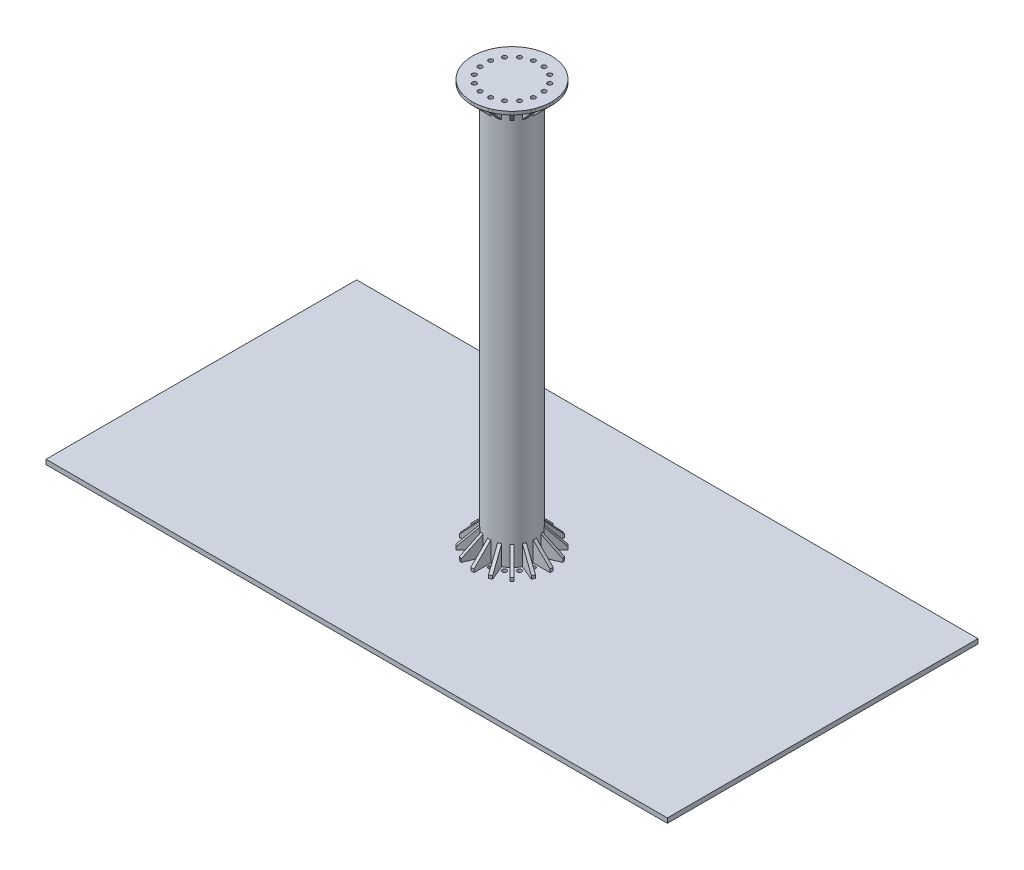
from build123d import *

# Parameters (mm, degrees)
SKETCH1_W                = 2000
SKETCH1_H                = 1000
BOSS_EXTRUDE1_DEPTH      = 15
SKETCH2_R                = 73.5
BOSS_EXTRUDE2_DEPTH      = 1300
SKETCH3_R                = 127.5
BOSS_EXTRUDE3_DEPTH      = 10
RIB1_START               = -5
RIB1_DEPTH               = 10
CIRPATTERN1_COUNT        = 16
MIRROR1_START            = -5
MIRROR1_DEPTH            = 10
MIRROR1_2_DEPTH          = 10
MIRROR1_3_DEPTH          = 10
MIRROR1_4_DEPTH          = 10
MIRROR1_5_DEPTH          = 10
MIRROR1_6_DEPTH          = 10
MIRROR1_7_DEPTH          = 10
MIRROR1_8_DEPTH          = 10
SKETCH6_R                = 7
CUT_EXTRUDE1_DEPTH       = 1727.043162844
CIRPATTERN2_COUNT        = 16
MIRROR2_COPY_1_SKETCH_R  = 7
MIRROR2_COPY_1_DEPTH     = 1727.043162844
MIRROR2_COPY_2_SKETCH_R  = 7
MIRROR2_COPY_2_DEPTH     = 1727.043162844
MIRROR2_COPY_3_SKETCH_R  = 7
MIRROR2_COPY_3_DEPTH     = 1727.043162844
MIRROR2_COPY_4_SKETCH_R  = 7
MIRROR2_COPY_4_DEPTH     = 1727.043162844
MIRROR2_COPY_5_SKETCH_R  = 7
MIRROR2_COPY_5_DEPTH     = 1727.043162844
MIRROR2_COPY_6_SKETCH_R  = 7
MIRROR2_COPY_6_DEPTH     = 1727.043162844
MIRROR2_COPY_7_SKETCH_R  = 7
MIRROR2_COPY_7_DEPTH     = 1727.043162844
MIRROR2_COPY_8_SKETCH_R  = 7
MIRROR2_COPY_8_DEPTH     = 1727.043162844
MIRROR2_COPY_9_SKETCH_R  = 7
MIRROR2_COPY_9_DEPTH     = 1727.043162844
MIRROR2_COPY_10_SKETCH_R = 7
MIRROR2_COPY_10_DEPTH    = 1727.043162844
MIRROR2_COPY_11_SKETCH_R = 7
MIRROR2_COPY_11_DEPTH    = 1727.043162844
MIRROR2_COPY_12_SKETCH_R = 7
MIRROR2_COPY_12_DEPTH    = 1727.043162844
MIRROR2_COPY_13_SKETCH_R = 7
MIRROR2_COPY_13_DEPTH    = 1727.043162844
MIRROR2_COPY_14_SKETCH_R = 7
MIRROR2_COPY_14_DEPTH    = 1727.043162844
MIRROR2_COPY_15_SKETCH_R = 7
MIRROR2_COPY_15_DEPTH    = 1727.043162844


with BuildPart() as part:
    # Sketch1 → Boss-Extrude1 (new body)
    with BuildSketch(Plane(origin=(0, 0, 0), x_dir=(1, 0, 0), z_dir=(0, 1, 0))):
        Rectangle(SKETCH1_W, SKETCH1_H)
    extrude(amount=BOSS_EXTRUDE1_DEPTH)

    # Sketch2 → Boss-Extrude2 (add)
    with BuildSketch(Plane(origin=(0, 15, 0), x_dir=(1, 0, 0), z_dir=(0, 1, 0))):
        with Locations(Location((0, 0, 0), (0, 0, 90))):
            Circle(SKETCH2_R)
    extrude(amount=BOSS_EXTRUDE2_DEPTH)

    # Sketch3 → Boss-Extrude3 (add)
    with BuildSketch(Plane(origin=(0, 1315, 0), x_dir=(1, 0, 0), z_dir=(0, 1, 0))):
        with Locations(Location((0, 0, 0), (0, 0, 270))):
            Circle(SKETCH3_R)
    extrude(amount=BOSS_EXTRUDE3_DEPTH)

    # Rib1: read off the stored shape, not the designer's step
    # Rib1 outline → Rib1 (add)
    with BuildSketch(Plane.XY.offset(RIB1_START)):
        Polygon((127.401923062, 1315), (73.32973476, 1315), (73.32973476, 1260.82973476), (127.5, 1315), (127.5, 1325), (127.401923062, 1325), align=None)
    rib1 = extrude(amount=RIB1_DEPTH)

    # CirPattern1: Rib1 ×16 about axis
    cirpattern1_axis = Axis((0, 0, 0), (0, 1, 0))
    for i in range(1, CIRPATTERN1_COUNT):
        add(rib1.rotate(cirpattern1_axis, i * 360 / CIRPATTERN1_COUNT))

    # Mirror1: read off the stored shape, not the designer's step
    # Mirror1 outline → Mirror1 (add)
    with BuildSketch(Plane.XY.offset(MIRROR1_START)):
        Polygon((127.5, 14), (127.5, 25), (72.5, 80), (-72.5, 80), (-127.5, 25), (-127.5, 14), align=None)
    extrude(amount=MIRROR1_DEPTH)

    # Mirror1 2 outline → Mirror1 2 (add)
    with BuildSketch(Plane(origin=(0, 0, 0), x_dir=(0.9238795325112862, 0, -0.38268343236509117), z_dir=(0.3826834323650911, 0, 0.9238795325112863)).offset(MIRROR1_START)):
        Polygon((127.5, 14), (127.5, 25), (72.5, 80), (-72.5, 80), (-127.5, 25), (-127.5, 14), align=None)
    extrude(amount=MIRROR1_2_DEPTH)

    # Mirror1 3 outline → Mirror1 3 (add)
    with BuildSketch(Plane(origin=(0, 0, 0), x_dir=(0.707106781186546, 0, -0.707106781186549), z_dir=(0.707106781186549, 0, 0.707106781186546)).offset(MIRROR1_START)):
        Polygon((127.5, 14), (127.5, 25), (72.5, 80), (-72.5, 80), (-127.5, 25), (-127.5, 14), align=None)
    extrude(amount=MIRROR1_3_DEPTH)

    # Mirror1 4 outline → Mirror1 4 (add)
    with BuildSketch(Plane(origin=(0, 0, 0), x_dir=(0, 1, 0), z_dir=(0.923879532511288, 0, 0.382683432365087)).offset(MIRROR1_START)):
        Polygon((14, -127.5), (25, -127.5), (80, -72.5), (80, 72.5), (25, 127.5), (14, 127.5), align=None)
    extrude(amount=MIRROR1_4_DEPTH)

    # Mirror1 5 outline → Mirror1 5 (add)
    with BuildSketch(Plane.YZ.offset(MIRROR1_START)):
        Polygon((14, -127.5), (25, -127.5), (80, -72.5), (80, 72.5), (25, 127.5), (14, 127.5), align=None)
    extrude(amount=MIRROR1_5_DEPTH)

    # Mirror1 6 outline → Mirror1 6 (add)
    with BuildSketch(Plane(origin=(0, 0, 0), x_dir=(0, 1, 0), z_dir=(0.9238795325112851, 0, -0.38268343236509406)).offset(MIRROR1_START)):
        Polygon((14, -127.5), (25, -127.5), (80, -72.5), (80, 72.5), (25, 127.5), (14, 127.5), align=None)
    extrude(amount=MIRROR1_6_DEPTH)

    # Mirror1 7 outline → Mirror1 7 (add)
    with BuildSketch(Plane(origin=(0, 0, 0), x_dir=(0.7071067811865509, 0, 0.707106781186544), z_dir=(0.707106781186544, 0, -0.707106781186551)).offset(MIRROR1_START)):
        Polygon((-127.5, -14), (-127.5, -25), (-72.5, -80), (72.5, -80), (127.5, -25), (127.5, -14), align=None)
    extrude(amount=MIRROR1_7_DEPTH)

    # Mirror1 8 outline → Mirror1 8 (add)
    with BuildSketch(Plane(origin=(0, 0, 0), x_dir=(0.9238795325112891, 0, 0.3826834323650842), z_dir=(0.3826834323650841, 0, -0.9238795325112892)).offset(MIRROR1_START)):
        Polygon((-127.5, -14), (-127.5, -25), (-72.5, -80), (72.5, -80), (127.5, -25), (127.5, -14), align=None)
    extrude(amount=MIRROR1_8_DEPTH)

    # Sketch6 → Cut-Extrude1 (cut, through all)
    with BuildSketch(Plane.XZ.offset(-1315)):
        with Locations(Location((17.175298589, -85.797780381, 0), (0, 0, 270))):
            Circle(SKETCH6_R)
    cut_extrude1 = extrude(amount=-CUT_EXTRUDE1_DEPTH, mode=Mode.SUBTRACT)

    # CirPattern2: Cut-Extrude1 ×16 about axis
    cirpattern2_axis = Axis((0, 0, 0), (0, 1, 0))
    for i in range(1, CIRPATTERN2_COUNT):
        add(cut_extrude1.rotate(cirpattern2_axis, i * 360 / CIRPATTERN2_COUNT), mode=Mode.SUBTRACT)

    # Mirror2: Cut-Extrude1 across plane
    add(cut_extrude1.mirror(Plane.ZX.offset(670)), mode=Mode.SUBTRACT)

    # Mirror2 copy 1 sketch → Mirror2 copy 1 (cut, through all)
    with BuildSketch(Plane(origin=(0, 25, 0), x_dir=(0.9238795325112867, 0, -0.3826834323650898), z_dir=(0, 1, 0))):
        with Locations((17.175298589, 85.797780381)):
            Circle(MIRROR2_COPY_1_SKETCH_R)
    extrude(amount=-MIRROR2_COPY_1_DEPTH, mode=Mode.SUBTRACT)

    # Mirror2 copy 2 sketch → Mirror2 copy 2 (cut, through all)
    with BuildSketch(Plane(origin=(0, 25, 0), x_dir=(0.7071067811865476, 0, -0.7071067811865475), z_dir=(0, 1, 0))):
        with Locations((17.175298589, 85.797780381)):
            Circle(MIRROR2_COPY_2_SKETCH_R)
    extrude(amount=-MIRROR2_COPY_2_DEPTH, mode=Mode.SUBTRACT)

    # Mirror2 copy 3 sketch → Mirror2 copy 3 (cut, through all)
    with BuildSketch(Plane(origin=(0, 25, 0), x_dir=(0.38268343236508984, 0, -0.9238795325112867), z_dir=(0, 1, 0))):
        with Locations((17.175298589, 85.797780381)):
            Circle(MIRROR2_COPY_3_SKETCH_R)
    extrude(amount=-MIRROR2_COPY_3_DEPTH, mode=Mode.SUBTRACT)

    # Mirror2 copy 4 sketch → Mirror2 copy 4 (cut, through all)
    with BuildSketch(Plane(origin=(0, 25, 0), x_dir=(0, 0, -1), z_dir=(0, 1, 0))):
        with Locations((17.175298589, 85.797780381)):
            Circle(MIRROR2_COPY_4_SKETCH_R)
    extrude(amount=-MIRROR2_COPY_4_DEPTH, mode=Mode.SUBTRACT)

    # Mirror2 copy 5 sketch → Mirror2 copy 5 (cut, through all)
    with BuildSketch(Plane(origin=(0, 25, 0), x_dir=(-0.3826834323650897, 0, -0.9238795325112867), z_dir=(0, 1, 0))):
        with Locations((17.175298589, 85.797780381)):
            Circle(MIRROR2_COPY_5_SKETCH_R)
    extrude(amount=-MIRROR2_COPY_5_DEPTH, mode=Mode.SUBTRACT)

    # Mirror2 copy 6 sketch → Mirror2 copy 6 (cut, through all)
    with BuildSketch(Plane(origin=(0, 25, 0), x_dir=(-0.7071067811865475, 0, -0.7071067811865476), z_dir=(0, 1, 0))):
        with Locations((17.175298589, 85.797780381)):
            Circle(MIRROR2_COPY_6_SKETCH_R)
    extrude(amount=-MIRROR2_COPY_6_DEPTH, mode=Mode.SUBTRACT)

    # Mirror2 copy 7 sketch → Mirror2 copy 7 (cut, through all)
    with BuildSketch(Plane(origin=(0, 25, 0), x_dir=(-0.9238795325112867, 0, -0.3826834323650899), z_dir=(0, 1, 0))):
        with Locations((17.175298589, 85.797780381)):
            Circle(MIRROR2_COPY_7_SKETCH_R)
    extrude(amount=-MIRROR2_COPY_7_DEPTH, mode=Mode.SUBTRACT)

    # Mirror2 copy 8 sketch → Mirror2 copy 8 (cut, through all)
    with BuildSketch(Plane(origin=(0, 25, 0), x_dir=(-1, 0, 0), z_dir=(0, 1, 0))):
        with Locations((17.175298589, 85.797780381)):
            Circle(MIRROR2_COPY_8_SKETCH_R)
    extrude(amount=-MIRROR2_COPY_8_DEPTH, mode=Mode.SUBTRACT)

    # Mirror2 copy 9 sketch → Mirror2 copy 9 (cut, through all)
    with BuildSketch(Plane(origin=(0, 25, 0), x_dir=(-0.9238795325112868, 0, 0.38268343236508967), z_dir=(0, 1, 0))):
        with Locations((17.175298589, 85.797780381)):
            Circle(MIRROR2_COPY_9_SKETCH_R)
    extrude(amount=-MIRROR2_COPY_9_DEPTH, mode=Mode.SUBTRACT)

    # Mirror2 copy 10 sketch → Mirror2 copy 10 (cut, through all)
    with BuildSketch(Plane(origin=(0, 25, 0), x_dir=(-0.7071067811865477, 0, 0.7071067811865475), z_dir=(0, 1, 0))):
        with Locations((17.175298589, 85.797780381)):
            Circle(MIRROR2_COPY_10_SKETCH_R)
    extrude(amount=-MIRROR2_COPY_10_DEPTH, mode=Mode.SUBTRACT)

    # Mirror2 copy 11 sketch → Mirror2 copy 11 (cut, through all)
    with BuildSketch(Plane(origin=(0, 25, 0), x_dir=(-0.3826834323650895, 0, 0.9238795325112868), z_dir=(0, 1, 0))):
        with Locations((17.175298589, 85.797780381)):
            Circle(MIRROR2_COPY_11_SKETCH_R)
    extrude(amount=-MIRROR2_COPY_11_DEPTH, mode=Mode.SUBTRACT)

    # Mirror2 copy 12 sketch → Mirror2 copy 12 (cut, through all)
    with BuildSketch(Plane.ZX.offset(25)):
        with Locations((17.175298589, 85.797780381)):
            Circle(MIRROR2_COPY_12_SKETCH_R)
    extrude(amount=-MIRROR2_COPY_12_DEPTH, mode=Mode.SUBTRACT)

    # Mirror2 copy 13 sketch → Mirror2 copy 13 (cut, through all)
    with BuildSketch(Plane(origin=(0, 25, 0), x_dir=(0.38268343236509, 0, 0.9238795325112866), z_dir=(0, 1, 0))):
        with Locations((17.175298589, 85.797780381)):
            Circle(MIRROR2_COPY_13_SKETCH_R)
    extrude(amount=-MIRROR2_COPY_13_DEPTH, mode=Mode.SUBTRACT)

    # Mirror2 copy 14 sketch → Mirror2 copy 14 (cut, through all)
    with BuildSketch(Plane(origin=(0, 25, 0), x_dir=(0.7071067811865474, 0, 0.7071067811865477), z_dir=(0, 1, 0))):
        with Locations((17.175298589, 85.797780381)):
            Circle(MIRROR2_COPY_14_SKETCH_R)
    extrude(amount=-MIRROR2_COPY_14_DEPTH, mode=Mode.SUBTRACT)

    # Mirror2 copy 15 sketch → Mirror2 copy 15 (cut, through all)
    with BuildSketch(Plane(origin=(0, 25, 0), x_dir=(0.9238795325112868, 0, 0.38268343236508956), z_dir=(0, 1, 0))):
        with Locations((17.175298589, 85.797780381)):
            Circle(MIRROR2_COPY_15_SKETCH_R)
    extrude(amount=-MIRROR2_COPY_15_DEPTH, mode=Mode.SUBTRACT)


solid = part.part
